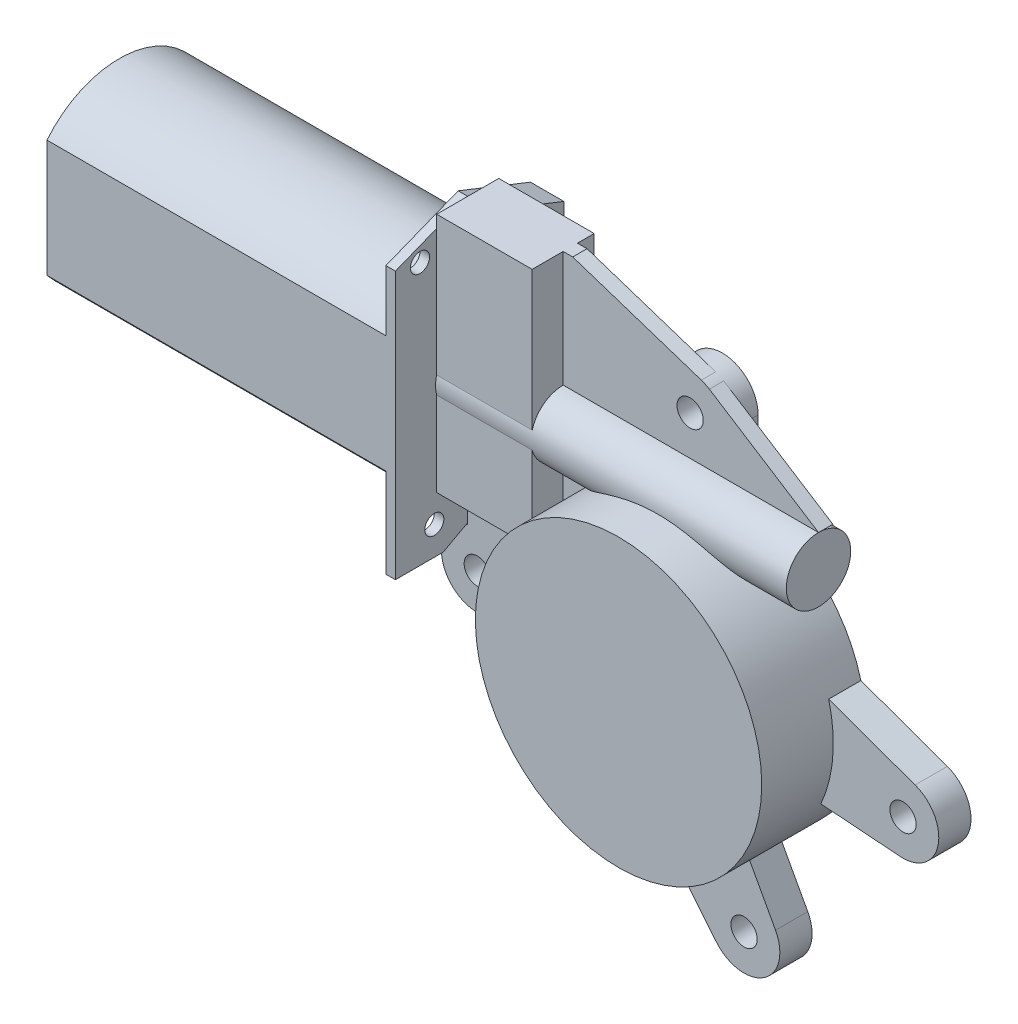
from build123d import *
from build123d.topology import SkipClean

# Parameters (mm, degrees)
EXTRUDE_1_DEPTH          = 71
SKETCH_3_R               = 7
EXTRUDE_2_DEPTH          = 0.8
SKETCH_4_R               = 2.25
EXTRUDE_3_DEPTH          = 0.2
SKETCH_5_R               = 2.5
SKETCH_5_R_2             = 2
EXTRUDE_4_DEPTH          = 2
SKETCH_7_R               = 6.75
EXTRUDE_7_DEPTH          = 73.5
SKETCH_6_R               = 30
EXTRUDE_8_DEPTH          = 15
EXTRUDE_START            = 6.75
SKETCH_8_R               = 2.75
EXTRUDE_9_DEPTH          = 6.75
EXTRUDE_START_2          = 3
SKETCH_9_R               = 2.75
EXTRUDE_10_DEPTH         = 3
SKETCH_10_W              = 20
SKETCH_10_H              = 50.5
EXTRUDE_11_DEPTH         = 6.5
EXTRUDE_19_DEPTH         = 18
SKETCH_13_R              = 10.5
EXTRUDE_20_DEPTH         = 7.5
SKETCH_14_R              = 5.85
SKETCH_14_R_2            = 5.5
CUT_EXTRUDE_1_DEPTH      = 0.1
CUT_EXTRUDE_2_DEPTH      = 7.5
EXTRUDE_23_DEPTH         = 5
CUT_EXTRUDE_3_DEPTH      = 0.5
CUT_EXTRUDE_4_DEPTH      = 7.5
PATTERN_CIRCULAR_1_COUNT = 8
MIRROR_1_COPY_1_DEPTH    = 7.5
MIRROR_1_COPY_2_DEPTH    = 7.5
MIRROR_1_COPY_3_DEPTH    = 7.5
MIRROR_1_COPY_4_DEPTH    = 7.5
MIRROR_1_COPY_5_DEPTH    = 7.5
MIRROR_1_COPY_6_DEPTH    = 7.5
MIRROR_1_COPY_7_DEPTH    = 7.5
SKETCH_20_W              = 172.7
SKETCH_20_H              = 112
CUT_EXTRUDE_5_DEPTH      = 133.738766003


with BuildPart() as part:
    # ｽｹｯﾁ2 → ﾎﾞｽ - 押し出し1 (new body)
    with BuildSketch(Plane(origin=(0, 0, 0), x_dir=(0, 0, -1), z_dir=(1, 0, 0))):
        with BuildLine():
            Line((15.15, 12.277112853), (15.15, -12.277112853))
            ThreePointArc((15.15, -12.277112853), (0, -19.5), (-15.15, -12.277112853))
            Line((-15.15, -12.277112853), (-15.15, 12.277112853))
            ThreePointArc((-15.15, 12.277112853), (0, 19.5), (15.15, 12.277112853))
        make_face()
    extrude_1 = extrude(amount=-EXTRUDE_1_DEPTH)

    # ｽｹｯﾁ3 → ﾎﾞｽ - 押し出し2 (add)
    with BuildSketch(Plane.ZY.offset(71)):
        Circle(SKETCH_3_R)
    extrude_2 = extrude(amount=EXTRUDE_2_DEPTH)

    # ｽｹｯﾁ4 → ﾎﾞｽ - 押し出し3 (add)
    with BuildSketch(Plane.ZY.offset(71.8)):
        Circle(SKETCH_4_R)
    extrude_3 = extrude(amount=EXTRUDE_3_DEPTH)

    # ｽｹｯﾁ5 → ﾎﾞｽ - 押し出し4 (add)
    with BuildSketch(Plane(origin=(0, 0, 0), x_dir=(0, 0, -1), z_dir=(1, 0, 0))):
        Polygon((-15.15, 25), (-15.15, -20), (5.15, -31), (15.15, -31), (15.15, 25), (0, 31), align=None)
        with Locations((0, 26)):
            Circle(SKETCH_5_R, mode=Mode.SUBTRACT)
        with Locations((-10, 24)):
            Circle(SKETCH_5_R_2, mode=Mode.SUBTRACT)
        with Locations((10, 24)):
            Circle(SKETCH_5_R_2, mode=Mode.SUBTRACT)
        with Locations((7, -25.039968051)):
            Circle(SKETCH_5_R_2, mode=Mode.SUBTRACT)
    extrude_4 = extrude(amount=EXTRUDE_4_DEPTH)

    # ｽｹｯﾁ7 → ﾎﾞｽ - 押し出し7 (add)
    with BuildSketch(Plane(origin=(2, 0, 0), x_dir=(0, 0, -1), z_dir=(1, 0, 0))):
        Circle(SKETCH_7_R)
    extrude_7 = extrude(amount=EXTRUDE_7_DEPTH)

    # ｽｹｯﾁ6 → ﾎﾞｽ - 押し出し8 (add)
    with BuildSketch(Plane.XY):
        with Locations((48.6, -30)):
            Circle(SKETCH_6_R)
    extrude_8 = extrude(amount=-EXTRUDE_8_DEPTH)

    # ｽｹｯﾁ8 → ﾎﾞｽ - 押し出し9 (add)
    with SkipClean():  # the faces are left unmerged after this step: merging them gives an invalid solid
        with BuildSketch(Plane.XY.offset(EXTRUDE_START)):
            with BuildLine():
                Line((54.103142752, -78.258828222), (37.3, -57.790465991))
                ThreePointArc((37.3, -57.790465991), (26.845559307, -50.657790543), (20.262693318, -39.848708037))
                Line((20.262693318, -39.848708037), (5.731866213, -43.297303572))
                ThreePointArc((5.731866213, -43.297303572), (-3.030535218, -38.611814416), (0.547494655, -29.341906666))
                Line((0.547494655, -29.341906666), (20.740658448, -18.87089005))
                ThreePointArc((20.740658448, -18.87089005), (28.779888618, -7.479716148), (41.1, -0.952624903))
                Line((41.1, -0.952624903), (41.1, 15))
                ThreePointArc((41.1, 15), (48.6, 22.5), (56.1, 15))
                Line((56.1, 15), (56.1, -0.952624903))
                ThreePointArc((56.1, -0.952624903), (69.784200745, -8.757833472), (77.626772672, -22.420655158))
                Line((77.626772672, -22.420655158), (95.741011533, -28.943566029))
                ThreePointArc((95.741011533, -28.943566029), (100.535659604, -37.561441057), (92.646930033, -43.479579775))
                Line((92.646930033, -43.479579775), (75.986056496, -42.247608321))
                ThreePointArc((75.986056496, -42.247608321), (69.445811281, -51.57434013), (59.9, -57.790465991))
                Line((59.9, -57.790465991), (66.490076017, -69.919371831))
                ThreePointArc((66.490076017, -69.919371831), (64.088547747, -79.721420077), (54.103142752, -78.258828222))
            make_face()
            with Locations((48.6, 15)):
                Circle(SKETCH_8_R, mode=Mode.SUBTRACT)
            with Locations((4, -36)):
                Circle(SKETCH_8_R, mode=Mode.SUBTRACT)
            with Locations((93.2, -36)):
                Circle(SKETCH_8_R, mode=Mode.SUBTRACT)
            with Locations((59.9, -73.5)):
                Circle(SKETCH_8_R, mode=Mode.SUBTRACT)
        extrude_9 = extrude(amount=-EXTRUDE_9_DEPTH)

    # ｽｹｯﾁ9 → ﾎﾞｽ - 押し出し10 (add)
    with SkipClean():  # the faces are left unmerged after this step: merging them gives an invalid solid
        with BuildSketch(Plane.XY.offset(EXTRUDE_START_2)):
            with BuildLine():
                Line((2, -28.588720699), (75.5, 6.75))
                Line((75.5, 6.75), (52.630824586, 21.324749256))
                ThreePointArc((52.630824586, 21.324749256), (51.813602008, 21.77663354), (50.946558479, 22.123458662))
                Line((50.946558479, 22.123458662), (24, 31))
                Line((24, 31), (2, 31))
                Line((2, 31), (2, -28.588720699))
            make_face()
            with Locations((48.6, 15)):
                Circle(SKETCH_9_R, mode=Mode.SUBTRACT)
        extrude_10 = extrude(amount=-EXTRUDE_10_DEPTH)

    # ｽｹｯﾁ10 → ﾎﾞｽ - 押し出し11 (add, symmetric)
    with SkipClean():  # the faces are left unmerged after this step: merging them gives an invalid solid
        with BuildSketch(Plane.XY):
            with Locations((12, 5.75)):
                Rectangle(SKETCH_10_W, SKETCH_10_H)
        extrude_11 = extrude(amount=EXTRUDE_11_DEPTH, both=True)

    # ｽｹｯﾁ12 → ﾎﾞｽ - 押し出し19 (add)
    with SkipClean():  # the faces are left unmerged after this step: merging them gives an invalid solid
        with BuildSketch(Plane(origin=(2, 0, 0), x_dir=(0, 0, -1), z_dir=(1, 0, 0))):
            Polygon((-15.15, 12), (-6.5, 19), (-6.5, -19), (-15.15, -12), align=None)
        extrude_19 = extrude(amount=EXTRUDE_19_DEPTH)

    # ｽｹｯﾁ13 → ﾎﾞｽ - 押し出し20 (add)
    with SkipClean():  # the faces are left unmerged after this step: merging them gives an invalid solid
        with BuildSketch(Plane.XY.offset(6.75)):
            with Locations((48.6, -30)):
                Circle(SKETCH_13_R)
        extrude_20 = extrude(amount=EXTRUDE_20_DEPTH)

    # ｽｹｯﾁ14 → ｶｯﾄ - 押し出し1 (cut)
    with SkipClean():  # the faces are left unmerged after this step: merging them gives an invalid solid
        with BuildSketch(Plane.XY.offset(14.25)):
            with Locations((48.6, -30)):
                Circle(SKETCH_14_R)
            with Locations((48.6, -30)):
                Circle(SKETCH_14_R_2, mode=Mode.SUBTRACT)
        cut_extrude_1 = extrude(amount=-CUT_EXTRUDE_1_DEPTH, mode=Mode.SUBTRACT)

    # ｽｹｯﾁ15 → ｶｯﾄ - 押し出し2 (cut)
    with SkipClean():  # the faces are left unmerged after this step: merging them gives an invalid solid
        with BuildSketch(Plane.XY.offset(15.15)):
            Polygon((20, 8), (9, -19), (20, -19), align=None)
        cut_extrude_2 = extrude(amount=-CUT_EXTRUDE_2_DEPTH, mode=Mode.SUBTRACT)

    # ｽｹｯﾁ16 → ﾎﾞｽ - 押し出し23 (add)
    with SkipClean():  # the faces are left unmerged after this step: merging them gives an invalid solid
        with BuildSketch(Plane(origin=(2, 0, 0), x_dir=(0, 0, -1), z_dir=(1, 0, 0))):
            Polygon((-6.5, 28.425742574), (-15.15, 25), (-15.15, -20), (-6.5, -24.687192118), align=None)
        extrude_23 = extrude(amount=EXTRUDE_23_DEPTH)

    # ｽｹｯﾁ17 → ｶｯﾄ - 押し出し3 (cut)
    with SkipClean():  # the faces are left unmerged after this step: merging them gives an invalid solid
        with BuildSketch(Plane.XY.offset(6.75)):
            Polygon((57.97110506, -18.933265077), (57.465434211, -18.427594227), (60.373041595, -14.625698581), (36.100840823, -14.625698581), (36.100840823, -12.233126322), (60.373041595, -12.233126322), (57.465434211, -8.440594951), (57.97110506, -7.934924102), (65.176914664, -13.370885733), (65.176914664, -13.497303445), align=None)
        cut_extrude_3 = extrude(amount=-CUT_EXTRUDE_3_DEPTH, mode=Mode.SUBTRACT)

    # ｽｹｯﾁ18 → ｶｯﾄ - 押し出し4 (cut)
    with SkipClean():  # the faces are left unmerged after this step: merging them gives an invalid solid
        with BuildSketch(Plane.XY.offset(14.25)):
            with BuildLine():
                ThreePointArc((52.571987006, -20.28026136), (48.6, -19.5), (44.628012994, -20.28026136))
                ThreePointArc((44.628012994, -20.28026136), (46.806938273, -21.727754746), (47.287462433, -24.299145228))
                ThreePointArc((47.287462433, -24.299145228), (48.6, -24.15), (49.912537567, -24.299145228))
                ThreePointArc((49.912537567, -24.299145228), (50.393061727, -21.727754746), (52.571987006, -20.28026136))
            make_face()
        cut_extrude_4 = extrude(amount=-CUT_EXTRUDE_4_DEPTH, mode=Mode.SUBTRACT)

    # 円形ﾊﾟﾀｰﾝ1: ｶｯﾄ - 押し出し4 ×8 about axis
    with SkipClean():  # the faces are left unmerged after this step: merging them gives an invalid solid
        pattern_circular_1_axis = Axis((48.6, -30, -7.5), (0, 0, 1))
        for i in range(1, PATTERN_CIRCULAR_1_COUNT):
            add(cut_extrude_4.rotate(pattern_circular_1_axis, i * 360 / PATTERN_CIRCULAR_1_COUNT), mode=Mode.SUBTRACT)

    # ﾐﾗｰ1: ﾎﾞｽ - 押し出し1, ﾎﾞｽ - 押し出し2, ﾎﾞｽ - 押し出し3, ﾎﾞｽ - 押し出し4, ﾎﾞｽ - 押し出し7, ﾎﾞｽ - 押し出し8, ﾎﾞｽ - 押し出し9, ﾎﾞｽ - 押し出し10, ﾎﾞｽ - 押し出し11, ﾎﾞｽ - 押し出し19, ﾎﾞｽ - 押し出し20, ｶｯﾄ - 押し出し1, ｶｯﾄ - 押し出し2, ﾎﾞｽ - 押し出し23, ｶｯﾄ - 押し出し3, ｶｯﾄ - 押し出し4 across plane
    with SkipClean():  # the faces are left unmerged after this step: merging them gives an invalid solid
        add(extrude_1.mirror(Plane.XY.offset(15.15)))
        add(extrude_2.mirror(Plane.XY.offset(15.15)))
        add(extrude_3.mirror(Plane.XY.offset(15.15)))
        add(extrude_4.mirror(Plane.XY.offset(15.15)))
        add(extrude_7.mirror(Plane.XY.offset(15.15)))
        add(extrude_8.mirror(Plane.XY.offset(15.15)))
        add(extrude_9.mirror(Plane.XY.offset(15.15)))
        add(extrude_10.mirror(Plane.XY.offset(15.15)))
        add(extrude_11.mirror(Plane.XY.offset(15.15)))
        add(extrude_19.mirror(Plane.XY.offset(15.15)))
        add(extrude_20.mirror(Plane.XY.offset(15.15)))
        add(cut_extrude_1.mirror(Plane.XY.offset(15.15)), mode=Mode.SUBTRACT)
        add(cut_extrude_2.mirror(Plane.XY.offset(15.15)), mode=Mode.SUBTRACT)
        add(extrude_23.mirror(Plane.XY.offset(15.15)))
        add(cut_extrude_3.mirror(Plane.XY.offset(15.15)), mode=Mode.SUBTRACT)
        add(cut_extrude_4.mirror(Plane.XY.offset(15.15)), mode=Mode.SUBTRACT)

    # ﾐﾗｰ1 copy 1 sketch → ﾐﾗｰ1 copy 1 (cut)
    with SkipClean():  # the faces are left unmerged after this step: merging them gives an invalid solid
        with BuildSketch(Plane(origin=(-6.978593001, -43.15218613, 16.05), x_dir=(0.7071067811865476, 0.7071067811865475, 0), z_dir=(0, 0, -1))):
            with BuildLine():
                ThreePointArc((52.571987006, 20.28026136), (48.6, 19.5), (44.628012994, 20.28026136))
                ThreePointArc((44.628012994, 20.28026136), (46.806938273, 21.727754746), (47.287462433, 24.299145228))
                ThreePointArc((47.287462433, 24.299145228), (48.6, 24.15), (49.912537567, 24.299145228))
                ThreePointArc((49.912537567, 24.299145228), (50.393061727, 21.727754746), (52.571987006, 20.28026136))
            make_face()
        extrude(amount=-MIRROR_1_COPY_1_DEPTH, mode=Mode.SUBTRACT)

    # ﾐﾗｰ1 copy 2 sketch → ﾐﾗｰ1 copy 2 (cut)
    with SkipClean():  # the faces are left unmerged after this step: merging them gives an invalid solid
        with BuildSketch(Plane(origin=(18.6, -78.6, 16.05), x_dir=(0, 1, 0), z_dir=(0, 0, -1))):
            with BuildLine():
                ThreePointArc((52.571987006, 20.28026136), (48.6, 19.5), (44.628012994, 20.28026136))
                ThreePointArc((44.628012994, 20.28026136), (46.806938273, 21.727754746), (47.287462433, 24.299145228))
                ThreePointArc((47.287462433, 24.299145228), (48.6, 24.15), (49.912537567, 24.299145228))
                ThreePointArc((49.912537567, 24.299145228), (50.393061727, 21.727754746), (52.571987006, 20.28026136))
            make_face()
        extrude(amount=-MIRROR_1_COPY_2_DEPTH, mode=Mode.SUBTRACT)

    # ﾐﾗｰ1 copy 3 sketch → ﾐﾗｰ1 copy 3 (cut)
    with SkipClean():  # the faces are left unmerged after this step: merging them gives an invalid solid
        with BuildSketch(Plane(origin=(61.75218613, -85.578593001, 16.05), x_dir=(-0.7071067811865475, 0.7071067811865476, 0), z_dir=(0, 0, -1))):
            with BuildLine():
                ThreePointArc((52.571987006, 20.28026136), (48.6, 19.5), (44.628012994, 20.28026136))
                ThreePointArc((44.628012994, 20.28026136), (46.806938273, 21.727754746), (47.287462433, 24.299145228))
                ThreePointArc((47.287462433, 24.299145228), (48.6, 24.15), (49.912537567, 24.299145228))
                ThreePointArc((49.912537567, 24.299145228), (50.393061727, 21.727754746), (52.571987006, 20.28026136))
            make_face()
        extrude(amount=-MIRROR_1_COPY_3_DEPTH, mode=Mode.SUBTRACT)

    # ﾐﾗｰ1 copy 4 sketch → ﾐﾗｰ1 copy 4 (cut)
    with SkipClean():  # the faces are left unmerged after this step: merging them gives an invalid solid
        with BuildSketch(Plane(origin=(97.2, -60, 16.05), x_dir=(-1, 0, 0), z_dir=(0, 0, -1))):
            with BuildLine():
                ThreePointArc((52.571987006, 20.28026136), (48.6, 19.5), (44.628012994, 20.28026136))
                ThreePointArc((44.628012994, 20.28026136), (46.806938273, 21.727754746), (47.287462433, 24.299145228))
                ThreePointArc((47.287462433, 24.299145228), (48.6, 24.15), (49.912537567, 24.299145228))
                ThreePointArc((49.912537567, 24.299145228), (50.393061727, 21.727754746), (52.571987006, 20.28026136))
            make_face()
        extrude(amount=-MIRROR_1_COPY_4_DEPTH, mode=Mode.SUBTRACT)

    # ﾐﾗｰ1 copy 5 sketch → ﾐﾗｰ1 copy 5 (cut)
    with SkipClean():  # the faces are left unmerged after this step: merging them gives an invalid solid
        with BuildSketch(Plane(origin=(104.178593001, -16.84781387, 16.05), x_dir=(-0.7071067811865477, -0.7071067811865475, 0), z_dir=(0, 0, -1))):
            with BuildLine():
                ThreePointArc((52.571987006, 20.28026136), (48.6, 19.5), (44.628012994, 20.28026136))
                ThreePointArc((44.628012994, 20.28026136), (46.806938273, 21.727754746), (47.287462433, 24.299145228))
                ThreePointArc((47.287462433, 24.299145228), (48.6, 24.15), (49.912537567, 24.299145228))
                ThreePointArc((49.912537567, 24.299145228), (50.393061727, 21.727754746), (52.571987006, 20.28026136))
            make_face()
        extrude(amount=-MIRROR_1_COPY_5_DEPTH, mode=Mode.SUBTRACT)

    # ﾐﾗｰ1 copy 6 sketch → ﾐﾗｰ1 copy 6 (cut)
    with SkipClean():  # the faces are left unmerged after this step: merging them gives an invalid solid
        with BuildSketch(Plane(origin=(78.6, 18.6, 16.05), x_dir=(0, -1, 0), z_dir=(0, 0, -1))):
            with BuildLine():
                ThreePointArc((52.571987006, 20.28026136), (48.6, 19.5), (44.628012994, 20.28026136))
                ThreePointArc((44.628012994, 20.28026136), (46.806938273, 21.727754746), (47.287462433, 24.299145228))
                ThreePointArc((47.287462433, 24.299145228), (48.6, 24.15), (49.912537567, 24.299145228))
                ThreePointArc((49.912537567, 24.299145228), (50.393061727, 21.727754746), (52.571987006, 20.28026136))
            make_face()
        extrude(amount=-MIRROR_1_COPY_6_DEPTH, mode=Mode.SUBTRACT)

    # ﾐﾗｰ1 copy 7 sketch → ﾐﾗｰ1 copy 7 (cut)
    with SkipClean():  # the faces are left unmerged after this step: merging them gives an invalid solid
        with BuildSketch(Plane(origin=(35.44781387, 25.578593001, 16.05), x_dir=(0.7071067811865474, -0.7071067811865477, 0), z_dir=(0, 0, -1))):
            with BuildLine():
                ThreePointArc((52.571987006, 20.28026136), (48.6, 19.5), (44.628012994, 20.28026136))
                ThreePointArc((44.628012994, 20.28026136), (46.806938273, 21.727754746), (47.287462433, 24.299145228))
                ThreePointArc((47.287462433, 24.299145228), (48.6, 24.15), (49.912537567, 24.299145228))
                ThreePointArc((49.912537567, 24.299145228), (50.393061727, 21.727754746), (52.571987006, 20.28026136))
            make_face()
        extrude(amount=-MIRROR_1_COPY_7_DEPTH, mode=Mode.SUBTRACT)

    # ｽｹｯﾁ20 → ｶｯﾄ - 押し出し5 (cut, through all)
    with SkipClean():  # the faces are left unmerged after this step: merging them gives an invalid solid
        with BuildSketch(Plane.XY.offset(15.15)):
            with Locations((14.35, -25)):
                Rectangle(SKETCH_20_W, SKETCH_20_H)
        extrude(amount=-CUT_EXTRUDE_5_DEPTH, mode=Mode.SUBTRACT)


solid = part.part
